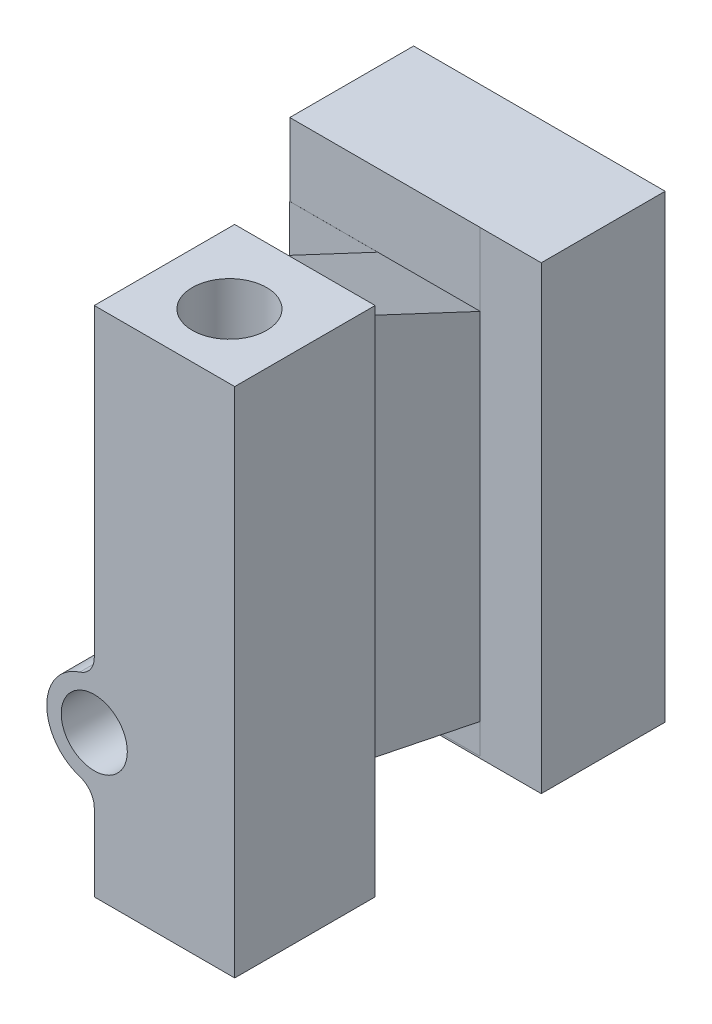
from build123d import *

# Parameters (mm, degrees)
SKETCH1_W           = 34
SKETCH1_H           = 124
BOSS_EXTRUDE1_DEPTH = 34
SKETCH2_R           = 11.504012884
BOSS_EXTRUDE2_DEPTH = 34
FILLET1_R           = 5
SKETCH3_R           = 13.586232418
CUT_EXTRUDE1_DEPTH  = 50
SKETCH4_R           = 8
CUT_EXTRUDE2_DEPTH  = 20
SKETCH5_W           = 24.830906905
SKETCH5_H           = 111.203932215
BOSS_EXTRUDE3_DEPTH = 30
SKETCH6_W           = 60.899939779
SKETCH6_H           = 111.310961987
BOSS_EXTRUDE4_DEPTH = 30
SKETCH7_R           = 8.998724885
CUT_EXTRUDE3_DEPTH  = 100
CUT_EXTRUDE5_DEPTH  = 100
SKETCH10_R          = 8.086489114
CUT_EXTRUDE6_DEPTH  = 10


with BuildPart() as part:
    # Sketch1 → Boss-Extrude1 (new body)
    with BuildSketch(Plane.XY):
        with Locations((-5.18125, -12.690625)):
            Rectangle(SKETCH1_W, SKETCH1_H)
    extrude(amount=BOSS_EXTRUDE1_DEPTH)

    # Sketch2 → Boss-Extrude2 (add)
    with BuildSketch(Plane.XY.offset(34)):
        with Locations((-22.18125, -40.250791069)):
            Circle(SKETCH2_R)
    extrude(amount=-BOSS_EXTRUDE2_DEPTH)

    # Fillet1
    fillet1_edges = [part.edges().sort_by_distance(p)[0] for p in [
        (-22.18125, -51.754803953, 17),
        (-22.18125, -28.746778185, 17),
    ]]
    fillet(fillet1_edges, radius=FILLET1_R)

    # Sketch3 → Cut-Extrude1 (cut)
    with BuildSketch(Plane.XZ.offset(74.690625)):
        with Locations((-4.893604294, 17.106225038)):
            Circle(SKETCH3_R)
    extrude(amount=-CUT_EXTRUDE1_DEPTH, mode=Mode.SUBTRACT)

    # Sketch4 → Cut-Extrude2 (cut)
    with BuildSketch(Plane.XY.offset(34)):
        with Locations((-22.18125, -40.250791069)):
            Circle(SKETCH4_R)
    extrude(amount=-CUT_EXTRUDE2_DEPTH, mode=Mode.SUBTRACT)

    # Sketch5 → Boss-Extrude3 (add)
    with BuildSketch(Plane(origin=(0, 0, 0), x_dir=(-1, 0, 0), z_dir=(0, 0, -1))):
        with Locations((5.153648801, -6.911017359)):
            Rectangle(SKETCH5_W, SKETCH5_H)
    extrude(amount=BOSS_EXTRUDE3_DEPTH)

    # Sketch6 → Boss-Extrude4 (add)
    with BuildSketch(Plane(origin=(0, 0, -30), x_dir=(-1, 0, 0), z_dir=(0, 0, -1))):
        with Locations((8.418056821, -7.285621558)):
            Rectangle(SKETCH6_W, SKETCH6_H)
    extrude(amount=BOSS_EXTRUDE4_DEPTH)

    # Sketch7 → Cut-Extrude3 (cut)
    with BuildSketch(Plane(origin=(0, 49.309375, 0), x_dir=(1, 0, 0), z_dir=(0, 1, 0))):
        with Locations((-5.091502482, -18.358859801)):
            Circle(SKETCH7_R)
    extrude(amount=-CUT_EXTRUDE3_DEPTH, mode=Mode.SUBTRACT)

    # Sketch9 → Cut-Extrude5 (cut)
    with BuildSketch(Plane(origin=(7.261804652, 0, 0), x_dir=(0, 0, -1), z_dir=(1, 0, 0))):
        Polygon((-0.011900431, 53.158400833), (-0.011900431, 44.862473141), (30.018715365, 30.783528167), (30.018715365, 53.158400833), align=None)
        Polygon((-0.011900431, -49.028418821), (-0.011900431, -66.373805341), (29.994778619, -69.28142928), (29.994778619, -55.173209223), align=None)
    extrude(amount=-CUT_EXTRUDE5_DEPTH, mode=Mode.SUBTRACT)

    # Sketch10 → Cut-Extrude6 (cut)
    with BuildSketch(Plane.ZY.offset(38.86802671)):
        with Locations((-45, -22.941102551)):
            Circle(SKETCH10_R)
    extrude(amount=-CUT_EXTRUDE6_DEPTH, mode=Mode.SUBTRACT)


solid = part.part
